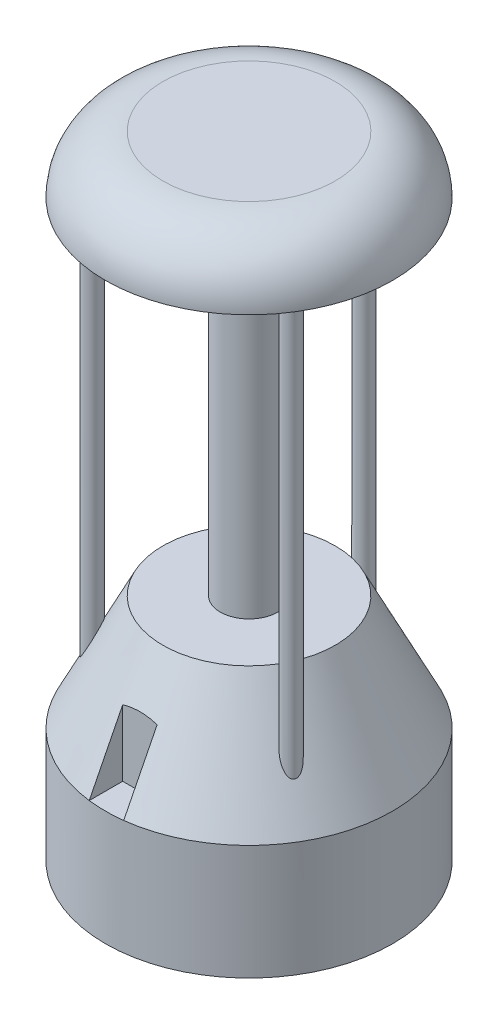
from build123d import *

# Parameters (mm, degrees)
SKETCH1_R             = 25
BOTTOM_CYLINDER_DEPTH = 20
SKETCH3_R             = 15
SKETCH2_R             = 25
SKETCH5_R             = 1.5
UVC_RODS_DEPTH        = 80
SKETCH6_R             = 25
TOP_DEPTH             = 10
FILLET1_R             = 10
LIDAR_CUBBY_REACH     = 98.695
SKETCH8_W             = 6
SKETCH8_H             = 6
BOSS_EXTRUDE1_REACH   = 80.422
SKETCH9_R             = 5


with BuildPart() as part:
    # Sketch1 → Bottom-cylinder (new body)
    with BuildSketch(Plane(origin=(0, 0, 0), x_dir=(1, 0, 0), z_dir=(0, 1, 0))):
        with Locations(Location((0, 0, 0), (0, 0, 270))):
            Circle(SKETCH1_R)
    extrude(amount=BOTTOM_CYLINDER_DEPTH)

    # Sketch3 → Cone-top section 0
    with BuildSketch(Plane(origin=(0, 40, 0), x_dir=(-1, 0, 0), z_dir=(0, -1, 0))):
        Circle(SKETCH3_R)
    # Sketch2 → Cone-top section 1
    with BuildSketch(Plane(origin=(0, 20, 0), x_dir=(1, 0, 0), z_dir=(0, 1, 0))):
        Circle(SKETCH2_R)
    loft()

    # Sketch5 → UVC-rods (add)
    with BuildSketch(Plane(origin=(0, 20, 0), x_dir=(1, 0, 0), z_dir=(0, 1, 0))):
        with Locations(Location((0, 20, 0), (0, 0, 90.000009577))):
            Circle(SKETCH5_R)
        with Locations(Location((17.320508076, -10, 0), (0, 0, 0.247467178))):
            Circle(SKETCH5_R)
        with Locations(Location((-17.320508076, -10, 0), (0, 0, 183.11947614))):
            Circle(SKETCH5_R)
    extrude(amount=UVC_RODS_DEPTH)

    # Sketch6 → Top (add)
    with BuildSketch(Plane(origin=(0, 100, 0), x_dir=(1, 0, 0), z_dir=(0, 1, 0))):
        with Locations(Location((0, 0, 0), (0, 0, 90))):
            Circle(SKETCH6_R)
    extrude(amount=TOP_DEPTH)

    # Fillet1
    fillet1_edges = [part.edges().sort_by_distance(p)[0] for p in [
        (0, 110, 25),
    ]]
    fillet(fillet1_edges, radius=FILLET1_R - 0.0001)  # a hair under: the kernel refuses the full size

    # Lidar-cubby: up to this cone (the profile starts inside it)
    lidar_cubby_end = Plane(origin=(0, 20, 0), z_dir=(0, -1, 0)).offset(-49.999999) * Cone(1e-06, 87.0975, 174.194999, align=(Align.CENTER, Align.CENTER, Align.MIN), mode=Mode.PRIVATE)
    # Sketch8 → Lidar-cubby (cut, up to the surface)
    with BuildSketch(Plane(origin=(0, 20, 0), x_dir=(1, 0, 0), z_dir=(0, 1, 0)), mode=Mode.PRIVATE) as lidar_cubby_sk1:
        with Locations((0, -22)):
            Rectangle(SKETCH8_W, SKETCH8_H)
    lidar_cubby_tool1 = extrude(lidar_cubby_sk1.sketch, amount=LIDAR_CUBBY_REACH, mode=Mode.PRIVATE) & lidar_cubby_end
    add(lidar_cubby_tool1.solids().sort_by_distance((0, 20, 22))[0], mode=Mode.SUBTRACT)

    # Sketch9 → Boss-Extrude1 (add, up to next)
    with BuildSketch(Plane(origin=(0, 40, 0), x_dir=(1, 0, 0), z_dir=(0, 1, 0)), mode=Mode.PRIVATE) as boss_extrude1_sk1:
        with Locations(Location((0, 0, 0), (0, 0, 270))):
            Circle(SKETCH9_R)
    boss_extrude1_tool1 = extrude(boss_extrude1_sk1.sketch, amount=BOSS_EXTRUDE1_REACH, mode=Mode.PRIVATE) - part.part
    add(boss_extrude1_tool1.solids().sort_by_distance((0, 40, 0))[0])


solid = part.part
